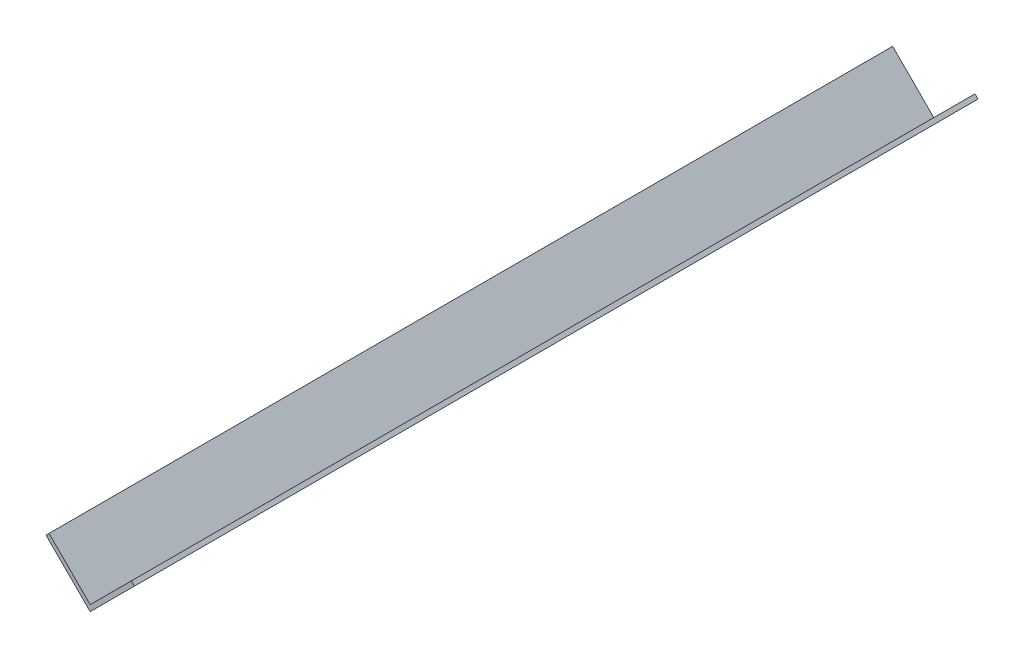
from build123d import *

# Parameters (mm, degrees)
BOSS_EXTRUDE1_DEPTH = 342.9


with BuildPart() as part:
    # Sketch1 → Boss-Extrude1 (new body)
    with BuildSketch(Plane.XY):
        Polygon((0, 0), (-17.960512242, 17.960512242), (-16.725727025, 19.195297459), (0, 2.469570433), (16.725727025, 19.195297459), (17.960512242, 17.960512242), align=None)
    extrude(amount=BOSS_EXTRUDE1_DEPTH)


solid = part.part
